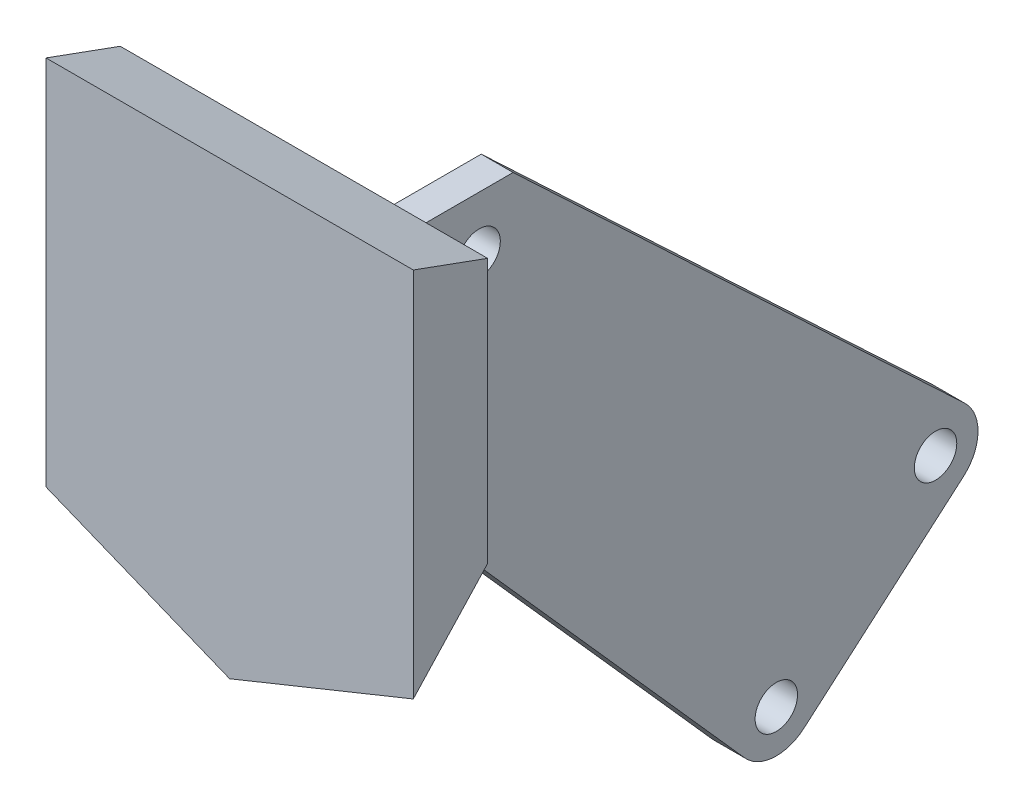
from build123d import *

# Parameters (mm, degrees)
RESSALTO_EXTRUS_O4_DEPTH = 7
CHANFRO1_SIZE            = 7
CHANFRO2_SIZE2           = 7
CHANFRO2_SIZE            = 2.54779164
RESSALTO_EXTRUS_O5_DEPTH = 12
ESBO_O13_R               = 2
CORTE_EXTRUS_O1_DEPTH    = 5
ESBO_O14_R               = 2
RESSALTO_EXTRUS_O6_DEPTH = 3


with BuildPart() as part:
    # Esboço10 → Ressalto-extrusão4 (new body)
    with BuildSketch(Plane.XY):
        Polygon((-17.3, -17.5), (0, -24.5), (17.3, -17.5), (17.3, 17.5), (-17.3, 17.5), align=None)
    extrude(amount=-RESSALTO_EXTRUS_O4_DEPTH)

    # Chanfro1
    chanfro1_edges = [part.edges().sort_by_distance(p)[0] for p in [
        (-8.65, -21, -7),
        (8.65, -21, -7),
    ]]
    chamfer(chanfro1_edges, length=CHANFRO1_SIZE - 0.0001)  # a hair under: the kernel refuses the full size

    # Chanfro2
    chanfro2_edges = [part.edges().sort_by_distance(p)[0] for p in [
        (0, 17.5, -7),
    ]]
    chanfro2_side = [part.faces().sort_by_distance(p)[0] for p in [
        (0, 17.449044167, -7),
    ]]
    chamfer(chanfro2_edges, length=CHANFRO2_SIZE - 0.0001, length2=CHANFRO2_SIZE2 - 0.0001, reference=chanfro2_side[0])  # a hair under: the kernel refuses the full size

    # Esboço12 → Ressalto-extrusão5 (add)
    with BuildSketch(Plane(origin=(0, 0, 0), x_dir=(1, 0, 0), z_dir=(0, 1, 0))):
        Polygon((-17.3, 7), (-23.5, 13.2), (-23.5, 15.2), (8.5, 15.2), (8.5, 7), align=None)
    extrude(amount=-RESSALTO_EXTRUS_O5_DEPTH)

    # Esboço13 → Corte-extrusão1 (cut)
    with BuildSketch(Plane(origin=(0, 0, -15.2), x_dir=(-1, 0, 0), z_dir=(0, 0, -1))):
        with Locations((0.5, -7.397915762)):
            Circle(ESBO_O13_R)
        with Locations((-5, -5)):
            Circle(ESBO_O13_R)
        with Locations(Location((20, -5, 0), (0, 0, 284.477512186))):
            Circle(ESBO_O13_R)
        with Locations(Location((14.5, -7.397915762, 0), (0, 0, 180))):
            Circle(ESBO_O13_R)
    extrude(amount=-CORTE_EXTRUS_O1_DEPTH, mode=Mode.SUBTRACT)

    # Esboço14 → Ressalto-extrusão6 (add)
    with BuildSketch(Plane(origin=(8.5, 0, 0), x_dir=(0, 0, -1), z_dir=(1, 0, 0))):
        with BuildLine():
            Line((57.743206586, -25.136637637), (15.2, 14.95220836))
            Line((15.2, 14.95220836), (7, 14.95220836))
            Line((7, 14.95220836), (7, -9.948687565))
            Line((7, -9.948687565), (37.010562028, -43.705471194))
            ThreePointArc((37.010562028, -43.705471194), (39.740206409, -45.039346135), (42.619722154, -44.070547971))
            Line((42.619722154, -44.070547971), (57.619722154, -31.070547971))
            ThreePointArc((57.619722154, -31.070547971), (58.999134172, -28.131013459), (57.743206586, -25.136637637))
        make_face()
        with Locations((12, 9.95220836)):
            Circle(ESBO_O14_R, mode=Mode.SUBTRACT)
        with Locations((55, -28.04779164)):
            Circle(ESBO_O14_R, mode=Mode.SUBTRACT)
        with Locations((40, -41.04779164)):
            Circle(ESBO_O14_R, mode=Mode.SUBTRACT)
    extrude(amount=RESSALTO_EXTRUS_O6_DEPTH)


solid = part.part
